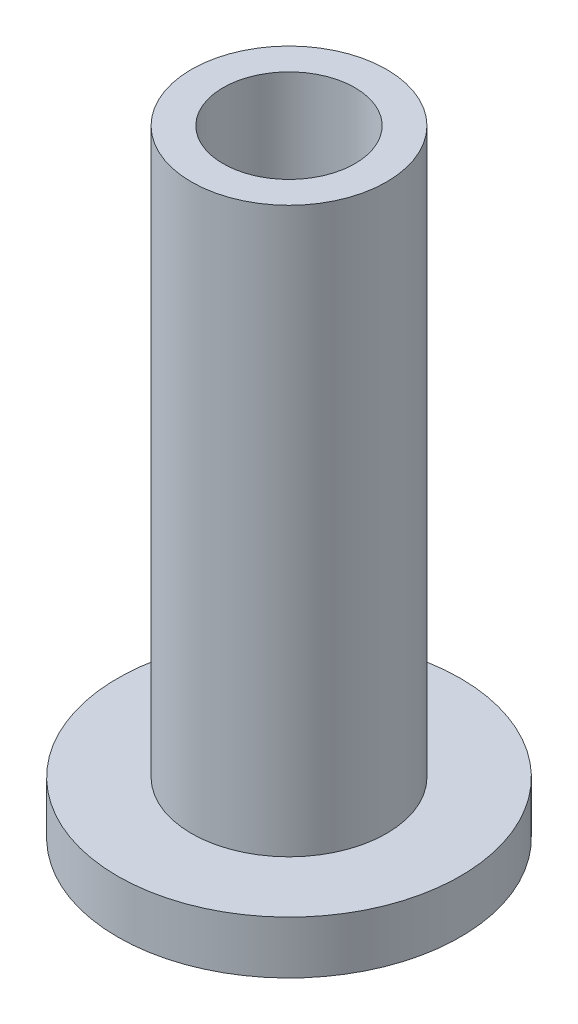
from build123d import *

# Parameters (mm, degrees)
SKETCH1_R           = 4.1275
BOSS_EXTRUDE1_DEPTH = 1.27
SKETCH2_R           = 2.3495
BOSS_EXTRUDE2_DEPTH = 13.589
SKETCH3_R           = 1.5875
CUT_EXTRUDE2_DEPTH  = 16.964410215


with BuildPart() as part:
    # Sketch1 → Boss-Extrude1 (new body)
    with BuildSketch(Plane(origin=(0, 0, 0), x_dir=(1, 0, 0), z_dir=(0, 1, 0))):
        Circle(SKETCH1_R)
    extrude(amount=BOSS_EXTRUDE1_DEPTH)

    # Sketch2 → Boss-Extrude2 (add)
    with BuildSketch(Plane(origin=(0, 1.27, 0), x_dir=(1, 0, 0), z_dir=(0, 1, 0))):
        Circle(SKETCH2_R)
    extrude(amount=BOSS_EXTRUDE2_DEPTH)

    # Sketch3 → Cut-Extrude2 (cut, through all)
    with BuildSketch(Plane.XZ):
        Circle(SKETCH3_R)
    extrude(amount=-CUT_EXTRUDE2_DEPTH, mode=Mode.SUBTRACT)


solid = part.part
